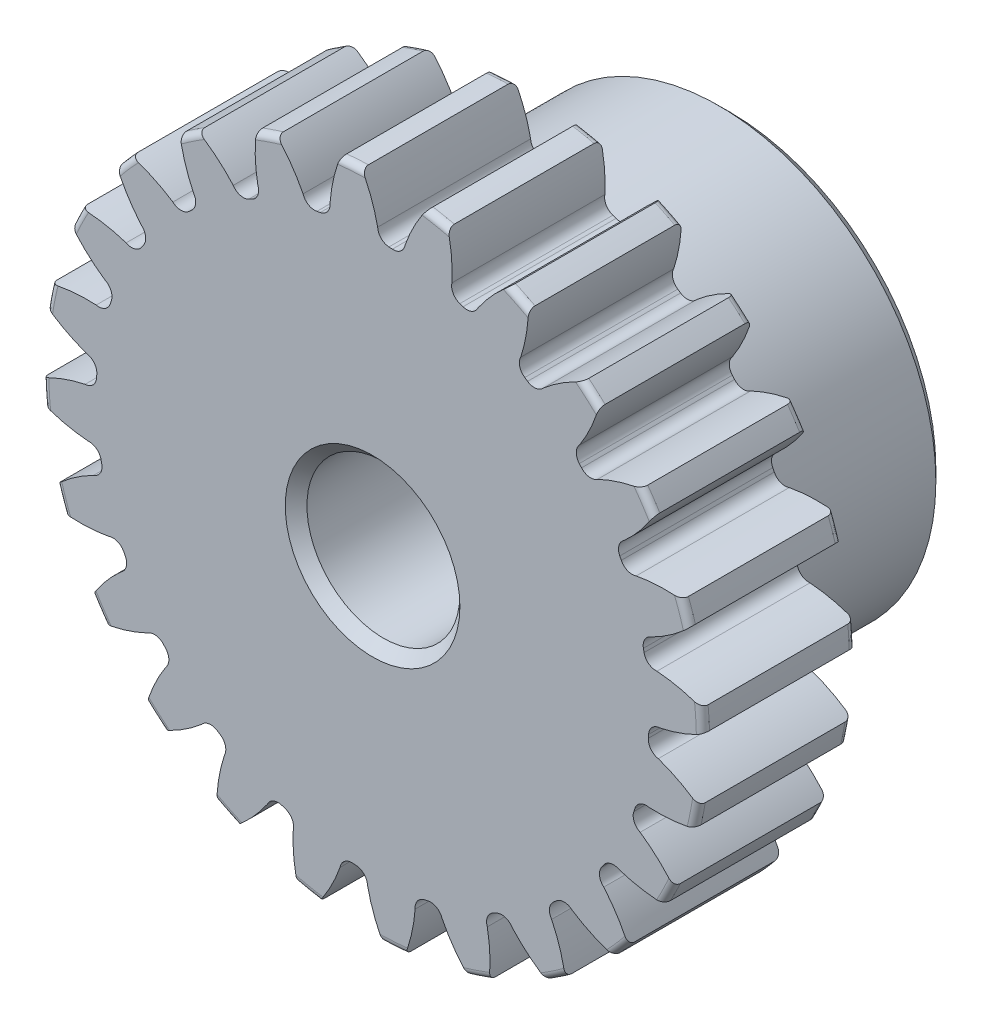
from build123d import *

# Parameters (mm, degrees)
SKETCH1_R                = 10.287
BOSS_EXTRUDE1_DEPTH      = 4.7625
SKETCH2_W                = 6.3627
SKETCH2_H                = 6.746875
FILLET2_R                = 0.20574
CUT_EXTRUDE1_DEPTH       = 19.314333597
FILLET1_R                = 0.37404675
CIRPATTERN1_COUNT        = 24
FILLET1_OF_CIRPATTERN1_R = 0.37404675
SKETCH5_R                = 2.38125
CUT_EXTRUDE2_DEPTH       = 19.308230577
CHAMFER1_SIZE            = 0.33734375


with BuildPart() as part:
    # Sketch1 → Boss-Extrude1 (new body)
    with BuildSketch(Plane.XY):
        Circle(SKETCH1_R)
    extrude(amount=-BOSS_EXTRUDE1_DEPTH)

    # Sketch2 → Revolve1 (revolve)
    with BuildSketch(Plane(origin=(0, 0, 0), x_dir=(0, 0, -1), z_dir=(1, 0, 0)), mode=Mode.PRIVATE) as revolve1_sk:
        with Locations((7.94385, 3.3734375)):
            Rectangle(SKETCH2_W, SKETCH2_H)
    revolve(revolve1_sk.sketch.rotate(Axis((0, 0, -4.7625), (0, 0, -1)), 90), axis=Axis((0, 0, -4.7625), (0, 0, -1)))

    # Fillet2
    fillet2_edges = [part.edges().sort_by_distance(p)[0] for p in [
        (-10.287, 0, 0),
        (-10.287, 0, -4.7625),
        (-6.746875, 0, -4.7625),
    ]]
    fillet(fillet2_edges, radius=FILLET2_R)

    # Sketch4 → Cut-Extrude1 (cut, through all)
    with BuildSketch(Plane.XY):
        with BuildLine():
            Line((0.158117624, 8.949175479), (0.158117624, 8.60517869))
            ThreePointArc((0.158117624, 8.60517869), (0.56290193, 8.588203706), (0.96643892, 8.552198389))
            Line((0.96643892, 8.552198389), (1.011339615, 8.893252224))
            add(Edge.make_bspline(
                [(4.116284711, 11.976179011), (1.74975278, 10.983781164), (1.011339615, 8.893252224)],
                knots=[0, 0, 0, 1, 1, 1], degree=2))
            ThreePointArc((4.116284711, 11.976179011), (0.828256233, 12.636718527), (-2.517860482, 12.411004879))
            add(Edge.make_bspline(
                [(-2.517860482, 12.411004879), (-0.301108868, 11.118202053), (0.158117624, 8.949175479)],
                knots=[0, 0, 0, 1, 1, 1], degree=2))
        make_face()
    cut_extrude1 = extrude(amount=-CUT_EXTRUDE1_DEPTH, mode=Mode.SUBTRACT)

    # Fillet1
    # the kernel refuses this fillet: 0.37404675 mm, written as the material it adds along each edge
    with BuildSketch(Plane(origin=(0.96643892, 8.552198389, 0), x_dir=(-0.995763033650264, 0.09195640714829735, 0), z_dir=(0, 0, -1))) as fillet1_piece_1:
        with BuildLine():
            CenterArc((0.359474733, 0.373968609), FILLET1_R, 184.635768929, 84.19305593)
            Line((-0.013348367, 0.343737708), (-0.020804829, 0.34313309))
            ThreePointArc((-0.020804829, 0.34313309), (-0.014149484, 0.171578566), (-0.007475301, -0.000290288))
            Line((-0.007475301, -0.000290288), (0.000152906, -0.007479372))
            ThreePointArc((0.000152906, -0.007479372), (0.175914713, -0.005682948), (0.351676521, -0.007479372))
            Line((0.351676521, -0.007479372), (0.351829427, 0))
        make_face()
    extrude(amount=4.7625)
    with BuildSketch(Plane(origin=(0.158117624, 8.60517869, 0), x_dir=(0, 1, 0), z_dir=(0, 0, -1))) as fillet1_piece_2:
        with BuildLine():
            CenterArc((0.359737985, 0.373715381), FILLET1_R, 183.395024894, 84.19305593)
            Line((-0.013652303, 0.351564447), (-0.021120109, 0.351121428))
            ThreePointArc((-0.021120109, 0.351121428), (-0.01250482, 0.175561704), (-0.007479672, -0.000137437))
            Line((-0.007479672, -0.000137437), (0, -0.007480935))
            ThreePointArc((0, -0.007480935), (0.171998394, -0.007480935), (0.343681965, -0.007474308))
            Line((0.343681965, -0.007474308), (0.343996789, 0))
        make_face()
    extrude(amount=4.7625)

    # CirPattern1: Cut-Extrude1 ×24 about axis
    cirpattern1_axis = Axis((0, 0, -4.7625), (0, 0, 1))
    for i in range(1, CIRPATTERN1_COUNT):
        add(cut_extrude1.rotate(cirpattern1_axis, i * 360 / CIRPATTERN1_COUNT), mode=Mode.SUBTRACT)

    # Fillet1 of CirPattern1
    # the kernel refuses this fillet: 0.37404675 mm, written as the material it adds along each edge
    with BuildSketch(Plane(origin=(-1.279963509, 8.510922094, 0), x_dir=(-0.9856333005559212, -0.16889936896045823, 0), z_dir=(0, 0, -1)), Plane(origin=(-3.439138539, 7.889640523, 0), x_dir=(-0.9083342868647343, -0.41824493219396514, 0), z_dir=(0, 0, -1)), Plane(origin=(-5.363941961, 6.730692989, 0), x_dir=(-0.7691337926171002, -0.6390877944808799, 0), z_dir=(0, 0, -1)), Plane(origin=(-6.923201603, 5.11305985, 0), x_dir=(-0.577518101456299, -0.8163778797164413, 0), z_dir=(0, 0, -1)), Plane(origin=(-8.010656497, 3.146980133, 0), x_dir=(-0.34654550607504214, -0.9380331615775601, 0), z_dir=(0, 0, -1)), Plane(origin=(-8.552198389, 0.96643892, 0), x_dir=(-0.09195640714829728, -0.995763033650264, 0), z_dir=(0, 0, -1)), Plane(origin=(-8.510922094, -1.279963509, 0), x_dir=(0.16889936896045823, -0.9856333005559212, 0), z_dir=(0, 0, -1)), Plane(origin=(-7.889640523, -3.439138539, 0), x_dir=(0.4182449321939642, -0.9083342868647348, 0), z_dir=(0, 0, -1)), Plane(origin=(-6.730692989, -5.363941961, 0), x_dir=(0.6390877944808785, -0.7691337926171015, 0), z_dir=(0, 0, -1)), Plane(origin=(-5.11305985, -6.923201603, 0), x_dir=(0.8163778797164399, -0.5775181014563006, 0), z_dir=(0, 0, -1)), Plane(origin=(-3.146980133, -8.010656497, 0), x_dir=(0.9380331615775596, -0.34654550607504336, 0), z_dir=(0, 0, -1)), Plane(origin=(-0.96643892, -8.552198389, 0), x_dir=(0.995763033650264, -0.0919564071482974, 0), z_dir=(0, 0, -1)), Plane(origin=(1.279963509, -8.510922094, 0), x_dir=(0.9856333005559212, 0.16889936896045823, 0), z_dir=(0, 0, -1)), Plane(origin=(3.439138539, -7.889640523, 0), x_dir=(0.9083342868647362, 0.41824493219396114, 0), z_dir=(0, 0, -1)), Plane(origin=(5.363941961, -6.730692989, 0), x_dir=(0.7691337926171005, 0.6390877944808797, 0), z_dir=(0, 0, -1)), Plane(origin=(6.923201603, -5.11305985, 0), x_dir=(0.577518101456299, 0.8163778797164413, 0), z_dir=(0, 0, -1)), Plane(origin=(8.010656497, -3.146980133, 0), x_dir=(0.34654550607504214, 0.9380331615775601, 0), z_dir=(0, 0, -1)), Plane(origin=(8.552198389, -0.96643892, 0), x_dir=(0.09195640714828739, 0.9957630336502649, 0), z_dir=(0, 0, -1)), Plane(origin=(8.510922094, 1.279963509, 0), x_dir=(-0.16889936896046306, 0.9856333005559205, 0), z_dir=(0, 0, -1)), Plane(origin=(7.889640523, 3.439138539, 0), x_dir=(-0.41824493219396114, 0.9083342868647362, 0), z_dir=(0, 0, -1)), Plane(origin=(6.730692989, 5.363941961, 0), x_dir=(-0.6390877944808785, 0.7691337926171015, 0), z_dir=(0, 0, -1)), Plane(origin=(5.11305985, 6.923201603, 0), x_dir=(-0.8163778797164413, 0.577518101456299, 0), z_dir=(0, 0, -1)), Plane(origin=(3.146980133, 8.010656497, 0), x_dir=(-0.9380331615775598, 0.346545506075043, 0), z_dir=(0, 0, -1))) as fillet1_of_cirpattern1_piece_1:
        with BuildLine():
            CenterArc((0.359474733, 0.373968609), FILLET1_OF_CIRPATTERN1_R, 184.635768929, 84.19305593)
            Line((-0.013348367, 0.343737708), (-0.020804829, 0.34313309))
            ThreePointArc((-0.020804829, 0.34313309), (-0.014149484, 0.171578566), (-0.007475301, -0.000290288))
            Line((-0.007475301, -0.000290288), (0.000152906, -0.007479372))
            ThreePointArc((0.000152906, -0.007479372), (0.175914713, -0.005682948), (0.351676521, -0.007479372))
            Line((0.351676521, -0.007479372), (0.351829427, 0))
        make_face()
    extrude(amount=4.7625)
    with BuildSketch(Plane(origin=(-2.074454235, 8.352888189, 0), x_dir=(-0.2588190451025208, 0.9659258262890683, 0), z_dir=(0, 0, -1)), Plane(origin=(-4.165655466, 7.531362162, 0), x_dir=(-0.5000000000000034, 0.8660254037844366, 0), z_dir=(0, 0, -1)), Plane(origin=(-5.972974161, 6.196586249, 0), x_dir=(-0.7071067811865501, 0.7071067811865449, 0), z_dir=(0, 0, -1)), Plane(origin=(-7.373244538, 4.439523224, 0), x_dir=(-0.8660254037844384, 0.5000000000000004, 0), z_dir=(0, 0, -1)), Plane(origin=(-8.271040484, 2.379914028, 0), x_dir=(-0.9659258262890679, 0.25881904510252196, 0), z_dir=(0, 0, -1)), Plane(origin=(-8.60517869, 0.158117624, 0), x_dir=(-1, 0, 0), z_dir=(0, 0, -1)), Plane(origin=(-8.352888189, -2.074454235, 0), x_dir=(-0.9659258262890683, -0.2588190451025208, 0), z_dir=(0, 0, -1)), Plane(origin=(-7.531362162, -4.165655466, 0), x_dir=(-0.8660254037844373, -0.5000000000000023, 0), z_dir=(0, 0, -1)), Plane(origin=(-6.196586249, -5.972974161, 0), x_dir=(-0.7071067811865476, -0.7071067811865476, 0), z_dir=(0, 0, -1)), Plane(origin=(-4.439523224, -7.373244538, 0), x_dir=(-0.5000000000000004, -0.8660254037844384, 0), z_dir=(0, 0, -1)), Plane(origin=(-2.379914028, -8.271040484, 0), x_dir=(-0.25881904510252196, -0.9659258262890679, 0), z_dir=(0, 0, -1)), Plane(origin=(-0.158117624, -8.60517869, 0), x_dir=(0, -1, 0), z_dir=(0, 0, -1)), Plane(origin=(2.074454235, -8.352888189, 0), x_dir=(0.2588190451025196, -0.9659258262890686, 0), z_dir=(0, 0, -1)), Plane(origin=(4.165655466, -7.531362162, 0), x_dir=(0.5000000000000004, -0.8660254037844384, 0), z_dir=(0, 0, -1)), Plane(origin=(5.972974161, -6.196586249, 0), x_dir=(0.7071067811865476, -0.7071067811865476, 0), z_dir=(0, 0, -1)), Plane(origin=(7.373244538, -4.439523224, 0), x_dir=(0.8660254037844384, -0.5000000000000004, 0), z_dir=(0, 0, -1)), Plane(origin=(8.271040484, -2.379914028, 0), x_dir=(0.9659258262890679, -0.25881904510252196, 0), z_dir=(0, 0, -1)), Plane(origin=(8.60517869, -0.158117624, 0), x_dir=(1, 0, 0), z_dir=(0, 0, -1)), Plane(origin=(8.352888189, 2.074454235, 0), x_dir=(0.9659258262890669, 0.2588190451025257, 0), z_dir=(0, 0, -1)), Plane(origin=(7.531362162, 4.165655466, 0), x_dir=(0.8660254037844384, 0.5000000000000004, 0), z_dir=(0, 0, -1)), Plane(origin=(6.196586249, 5.972974161, 0), x_dir=(0.7071067811865449, 0.7071067811865501, 0), z_dir=(0, 0, -1)), Plane(origin=(4.439523224, 7.373244538, 0), x_dir=(0.5000000000000004, 0.8660254037844384, 0), z_dir=(0, 0, -1)), Plane(origin=(2.379914028, 8.271040484, 0), x_dir=(0.25881904510252196, 0.9659258262890679, 0), z_dir=(0, 0, -1))) as fillet1_of_cirpattern1_piece_2:
        with BuildLine():
            CenterArc((0.359737985, 0.373715381), FILLET1_OF_CIRPATTERN1_R, 183.395024894, 84.19305593)
            Line((-0.013652303, 0.351564447), (-0.021120109, 0.351121428))
            ThreePointArc((-0.021120109, 0.351121428), (-0.01250482, 0.175561704), (-0.007479672, -0.000137437))
            Line((-0.007479672, -0.000137437), (0, -0.007480935))
            ThreePointArc((0, -0.007480935), (0.171998394, -0.007480935), (0.343681965, -0.007474308))
            Line((0.343681965, -0.007474308), (0.343996789, 0))
        make_face()
    extrude(amount=4.7625)

    # Sketch5 → Cut-Extrude2 (cut, through all)
    with BuildSketch(Plane.XY):
        Circle(SKETCH5_R)
    extrude(amount=-CUT_EXTRUDE2_DEPTH, mode=Mode.SUBTRACT)

    # Chamfer1
    chamfer1_edges = [part.edges().sort_by_distance(p)[0] for p in [
        (-6.746875, 0, -11.1252),
        (-2.38125, 0, -11.1252),
        (-2.38125, 0, 0),
    ]]
    chamfer(chamfer1_edges, length=CHAMFER1_SIZE)


solid = part.part
